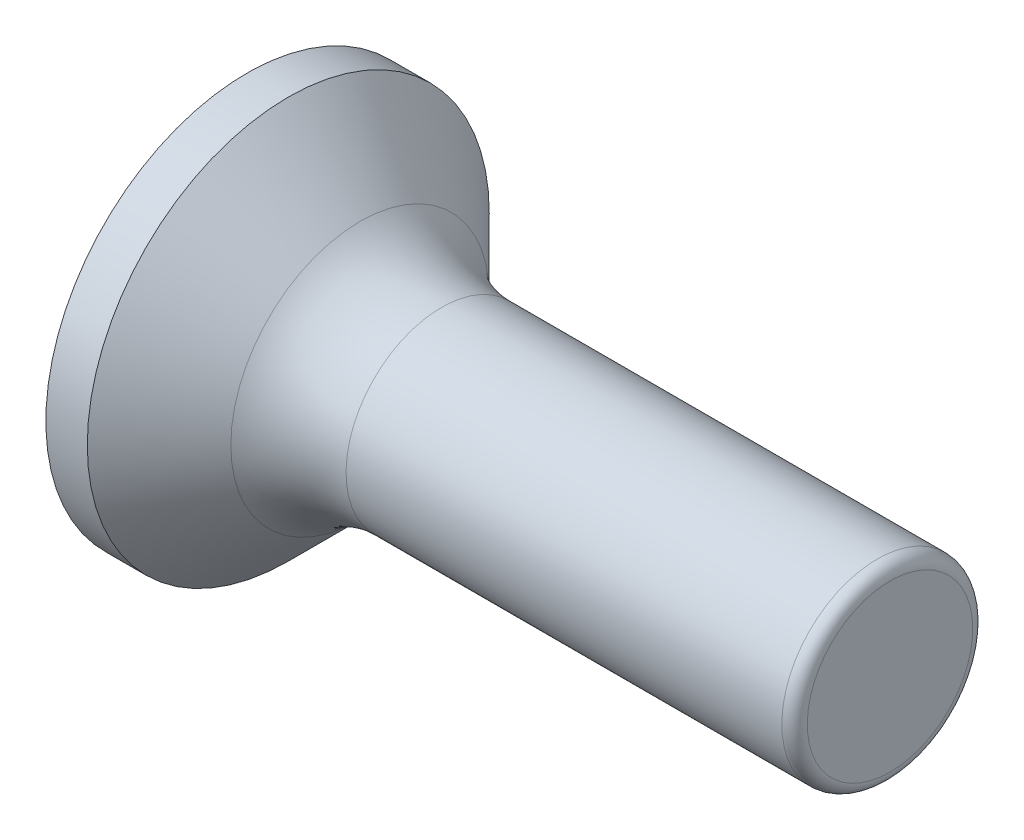
from build123d import *

# Parameters (mm, degrees)
CUT_EXTRUDE1_DEPTH = 2.815266277
DRAFT1_ANGLE       = -45
FILLET2_R          = 0.633333333


with BuildPart() as part:
    # Sketch1 → Base (revolve)
    with BuildSketch(Plane.XY):
        with BuildLine():
            Line((34.3, 0), (34.3, 4.75))
            Line((34.3, 4.75), (11.985125639, 4.75))
            ThreePointArc((11.985125639, 4.75), (9.790795674, 5.186479368), (7.930532554, 6.429467446))
            Line((7.930532554, 6.429467446), (4.36, 10))
            Line((4.36, 10), (2.3, 10))
            ThreePointArc((2.3, 10), (0.582409652, 5.13054578), (0, 0))
            Line((0, 0), (34.3, 0))
        make_face()
    revolve(axis=Axis((-18.093863788, 0, 0), (1, 0, 0)))

    # Sketch2 → Cut-Extrude1 (cut)
    with BuildSketch(Plane(origin=(0, 0, 0), x_dir=(0, 0, -1), z_dir=(1, 0, 0))):
        Polygon((-1.01, 5.05), (1.01, 5.05), (1.01, 1.01), (5.05, 1.01), (5.05, -1.01), (1.01, -1.01), (1.01, -5.05), (-1.01, -5.05), (-1.01, -1.01), (-5.05, -1.01), (-5.05, 1.01), (-1.01, 1.01), align=None)
    extrude(amount=CUT_EXTRUDE1_DEPTH, mode=Mode.SUBTRACT)

    # Draft1
    draft1_faces = [part.faces().sort_by_distance(p)[0] for p in [
        (1.693450262, -5.05, 0),
        (1.693450262, 0, -5.05),
        (1.693450262, 0, 5.05),
        (1.693450262, 5.05, 0),
    ]]
    draft(draft1_faces, Plane(origin=(0, 0, 0), x_dir=(0, 0, 1), z_dir=(1, 0, 0)), DRAFT1_ANGLE)

    # Fillet2
    fillet2_edges = [part.edges().sort_by_distance(p)[0] for p in [
        (34.3, -4.75, 0),
    ]]
    fillet(fillet2_edges, radius=FILLET2_R)


solid = part.part
